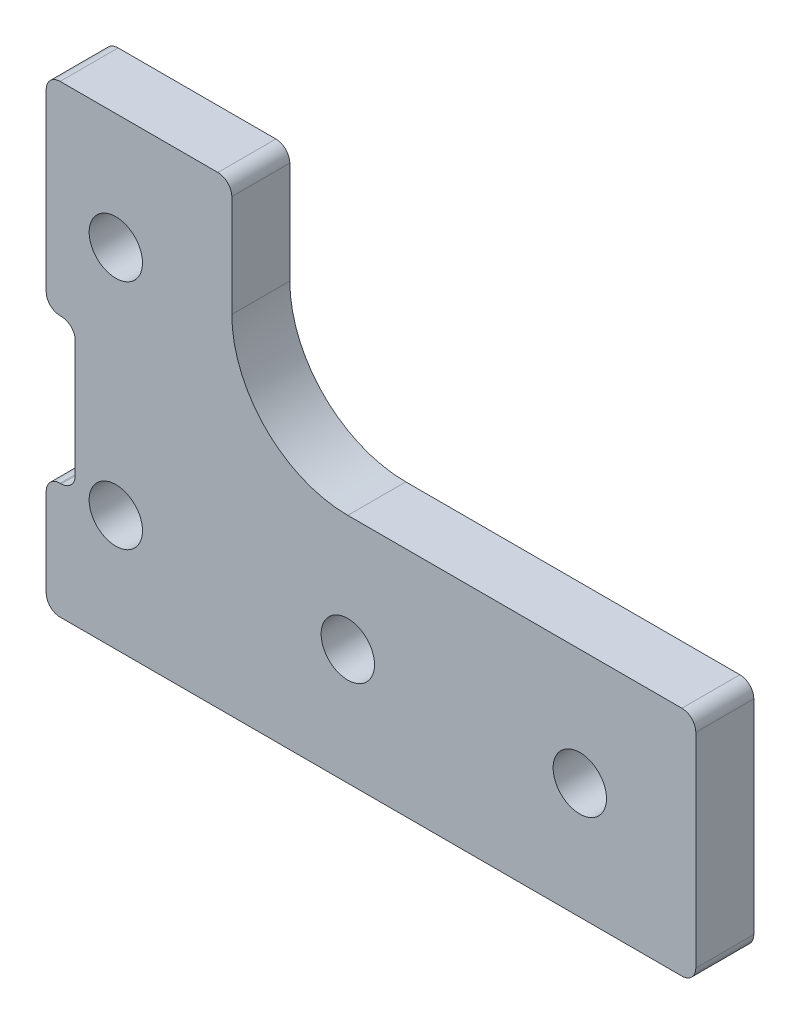
from build123d import *

# Parameters (mm, degrees)
BOSS_EXTRUDE1_DEPTH = 6.35
SKETCH2_R           = 2.921
CUT_EXTRUDE1_DEPTH  = 92.800885072
SKETCH3_W           = 5.08
SKETCH3_H           = 50.8
CUT_EXTRUDE2_DEPTH  = 92.800885072
FILLET1_R           = 12.7
SKETCH4_W           = 3.175
SKETCH4_H           = 15.875
CUT_EXTRUDE3_DEPTH  = 92.800885072
FILLET2_R           = 1.524


with BuildPart() as part:
    # Sketch1 → Boss-Extrude1 (new body)
    with BuildSketch(Plane.XY):
        Polygon((0, 0), (0, 50.8), (25.4, 50.8), (25.4, 25.4), (76.2, 25.4), (76.2, 0), align=None)
    extrude(amount=BOSS_EXTRUDE1_DEPTH)

    # Sketch2 → Cut-Extrude1 (cut, through all)
    with BuildSketch(Plane.XY.offset(6.35)):
        with Locations((12.7, 38.1)):
            Circle(SKETCH2_R)
        with Locations((12.7, 12.7)):
            Circle(SKETCH2_R)
        with Locations((38.1, 12.7)):
            Circle(SKETCH2_R)
        with Locations((63.5, 12.7)):
            Circle(SKETCH2_R)
    extrude(amount=-CUT_EXTRUDE1_DEPTH, mode=Mode.SUBTRACT)

    # Sketch3 → Cut-Extrude2 (cut, through all)
    with BuildSketch(Plane.XY.offset(6.35)):
        with Locations((2.54, 25.4)):
            Rectangle(SKETCH3_W, SKETCH3_H)
    extrude(amount=-CUT_EXTRUDE2_DEPTH, mode=Mode.SUBTRACT)

    # Fillet1
    fillet1_edges = [part.edges().sort_by_distance(p)[0] for p in [
        (25.4, 25.4, 3.175),
    ]]
    fillet(fillet1_edges, radius=FILLET1_R)

    # Sketch4 → Cut-Extrude3 (cut, through all)
    with BuildSketch(Plane.XY.offset(6.35)):
        with Locations((6.6675, 20.6375)):
            Rectangle(SKETCH4_W, SKETCH4_H)
    extrude(amount=-CUT_EXTRUDE3_DEPTH, mode=Mode.SUBTRACT)

    # Fillet2
    fillet2_edges = [part.edges().sort_by_distance(p)[0] for p in [
        (8.255, 12.7, 3.175),
        (5.08, 12.7, 3.175),
        (8.255, 28.575, 3.175),
        (5.08, 28.575, 3.175),
        (76.2, 0, 3.175),
        (76.2, 25.4, 3.175),
        (5.08, 0, 3.175),
        (25.4, 50.8, 3.175),
        (5.08, 50.8, 3.175),
    ]]
    fillet(fillet2_edges, radius=FILLET2_R)


solid = part.part
